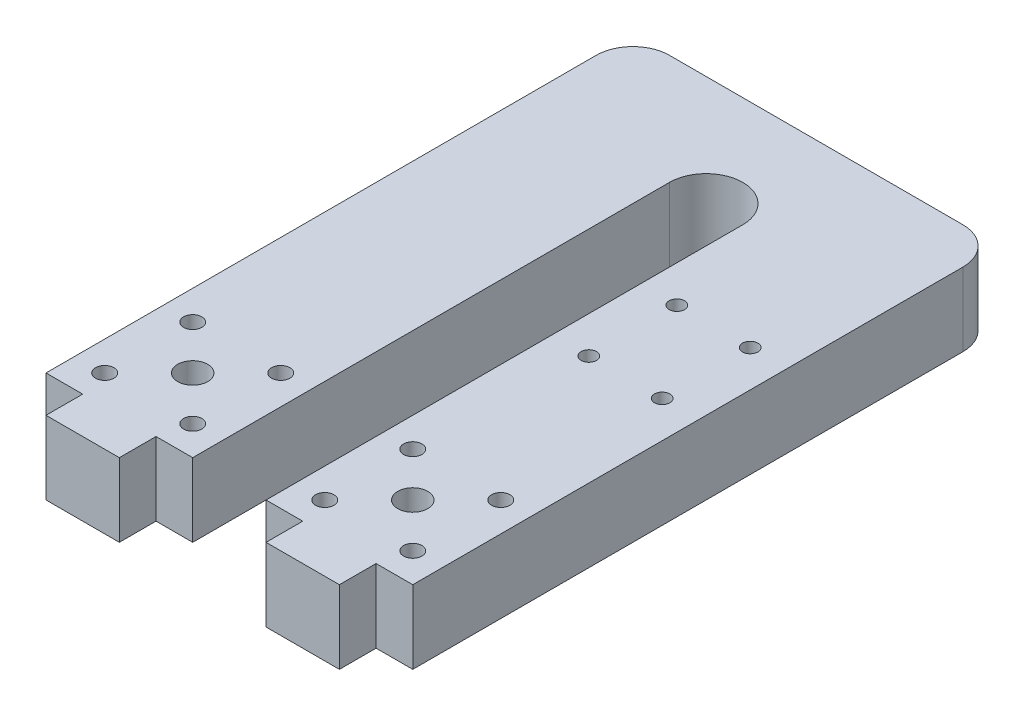
from build123d import *

# Parameters (mm, degrees)
SKETCH_1_R          = 4.1
SKETCH_1_R_2        = 2.5
EXTRUDE_1_DEPTH     = 20
SKETCH_2_W          = 20
SKETCH_2_H          = 140
CUT_EXTRUDE_1_DEPTH = 169.819430161
FILLET_1_R          = 10
SKETCH_3_W          = 20
SKETCH_3_H          = 20
EXTRUDE_2_DEPTH     = 10
SKETCH_4_W          = 20
SKETCH_4_H          = 20
EXTRUDE_3_DEPTH     = 10
SKETCH_5_R          = 2.1
CUT_EXTRUDE_2_DEPTH = 169.819430161


with BuildPart() as part:
    # ｽｹｯﾁ1 → ﾎﾞｽ - 押し出し1 (new body)
    with BuildSketch(Plane(origin=(0, 0, 0), x_dir=(1, 0, 0), z_dir=(0, 1, 0))):
        with BuildLine():
            Line((-50, 0), (50, 0))
            Line((50, 0), (50, 150))
            ThreePointArc((50, 150), (47.071067812, 157.071067812), (40, 160))
            Line((40, 160), (-40, 160))
            ThreePointArc((-40, 160), (-47.071067812, 157.071067812), (-50, 150))
            Line((-50, 150), (-50, 0))
        make_face()
        with Locations(Location((-30, 20, 0), (0, 0, 270))):
            Circle(SKETCH_1_R, mode=Mode.SUBTRACT)
        with Locations(Location((30, 20, 0), (0, 0, 270))):
            Circle(SKETCH_1_R, mode=Mode.SUBTRACT)
        with Locations(Location((-42, 32, 0), (0, 0, 270))):
            Circle(SKETCH_1_R_2, mode=Mode.SUBTRACT)
        with Locations(Location((-18, 32, 0), (0, 0, 270))):
            Circle(SKETCH_1_R_2, mode=Mode.SUBTRACT)
        with Locations(Location((-18, 8, 0), (0, 0, 270))):
            Circle(SKETCH_1_R_2, mode=Mode.SUBTRACT)
        with Locations(Location((-42, 8, 0), (0, 0, 270))):
            Circle(SKETCH_1_R_2, mode=Mode.SUBTRACT)
        with Locations(Location((18, 32, 0), (0, 0, 90))):
            Circle(SKETCH_1_R_2, mode=Mode.SUBTRACT)
        with Locations(Location((18, 8, 0), (0, 0, 90))):
            Circle(SKETCH_1_R_2, mode=Mode.SUBTRACT)
        with Locations(Location((42, 8, 0), (0, 0, 90))):
            Circle(SKETCH_1_R_2, mode=Mode.SUBTRACT)
        with Locations(Location((42, 32, 0), (0, 0, 90))):
            Circle(SKETCH_1_R_2, mode=Mode.SUBTRACT)
    extrude(amount=EXTRUDE_1_DEPTH)

    # ｽｹｯﾁ2 → ｶｯﾄ - 押し出し1 (cut, through all)
    with BuildSketch(Plane(origin=(0, 20, 0), x_dir=(1, 0, 0), z_dir=(0, 1, 0))):
        with Locations((0, 70)):
            Rectangle(SKETCH_2_W, SKETCH_2_H)
    extrude(amount=-CUT_EXTRUDE_1_DEPTH, mode=Mode.SUBTRACT)

    # ﾌｨﾚｯﾄ1
    fillet_1_edges = [part.edges().sort_by_distance(p)[0] for p in [
        (-10, 10, -140),
        (10, 10, -140),
    ]]
    fillet(fillet_1_edges, radius=FILLET_1_R - 0.0001)  # a hair under: the kernel refuses the full size

    # ｽｹｯﾁ3 → ﾎﾞｽ - 押し出し2 (add)
    with BuildSketch(Plane.XY):
        with Locations((30, 10)):
            Rectangle(SKETCH_3_W, SKETCH_3_H)
    extrude(amount=EXTRUDE_2_DEPTH)

    # ｽｹｯﾁ4 → ﾎﾞｽ - 押し出し3 (add)
    with BuildSketch(Plane.XY):
        with Locations((-30, 10)):
            Rectangle(SKETCH_4_W, SKETCH_4_H)
    extrude(amount=EXTRUDE_3_DEPTH)

    # ｽｹｯﾁ5 → ｶｯﾄ - 押し出し2 (cut, through all)
    with BuildSketch(Plane(origin=(0, 20, 0), x_dir=(1, 0, 0), z_dir=(0, 1, 0))):
        with Locations(Location((20, 102, 0), (0, 0, 270))):
            Circle(SKETCH_5_R)
        with Locations(Location((40, 102, 0), (0, 0, 270))):
            Circle(SKETCH_5_R)
        with Locations(Location((20, 78, 0), (0, 0, 270))):
            Circle(SKETCH_5_R)
        with Locations(Location((40, 78, 0), (0, 0, 270))):
            Circle(SKETCH_5_R)
    extrude(amount=-CUT_EXTRUDE_2_DEPTH, mode=Mode.SUBTRACT)


solid = part.part
